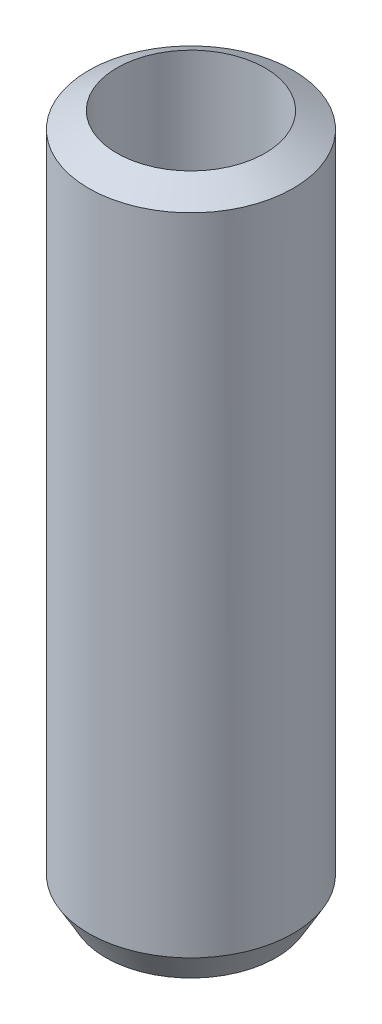
from build123d import *

# Parameters (mm, degrees)
SKETCH1_R           = 30
BOSS_EXTRUDE1_DEPTH = 202.993196
SKETCH2_R           = 21.720790464
CUT_EXTRUDE1_DEPTH  = 208.379453231
CHAMFER1_SIZE       = 4.98909
CHAMFER1_SIZE_2     = 8.641358


with BuildPart() as part:
    # Sketch1 → Boss-Extrude1 (new body)
    with BuildSketch(Plane(origin=(0, 0, 0), x_dir=(1, 0, 0), z_dir=(0, 1, 0))):
        with Locations(Location((0, 0, 0), (0, 0, 270))):
            Circle(SKETCH1_R)
    extrude(amount=BOSS_EXTRUDE1_DEPTH)

    # Sketch2 → Cut-Extrude1 (cut, through all)
    with BuildSketch(Plane(origin=(0, 0, 0), x_dir=(1, 0, 0), z_dir=(0, 1, 0))):
        with Locations(Location((0, 0, 0), (0, 0, 270))):
            Circle(SKETCH2_R)
    extrude(amount=CUT_EXTRUDE1_DEPTH, mode=Mode.SUBTRACT)

    # Chamfer1
    # the kernel refuses this chamfer: 8.641358, 4.98909 mm, written as the material it takes off along each edge
    with BuildSketch(Plane(origin=(0, 202.993196, 0), x_dir=(0, 0, 1), z_dir=(-1, 0, 0))) as chamfer1_piece_1:
        Polygon((30, -CHAMFER1_SIZE), (30 - CHAMFER1_SIZE_2, 0), (30, 0), align=None)
    revolve(axis=Axis((0, 202.993196, 0), (0, 1, 0)), mode=Mode.SUBTRACT)
    with BuildSketch(Plane(origin=(0, 0, 0), x_dir=(0, 0, 1), z_dir=(-1, 0, 0))) as chamfer1_piece_2:
        Polygon((30, CHAMFER1_SIZE_2), (30 - CHAMFER1_SIZE, 0), (30, 0), align=None)
    revolve(axis=Axis((0, 0, 0), (0, 1, 0)), mode=Mode.SUBTRACT)


solid = part.part
